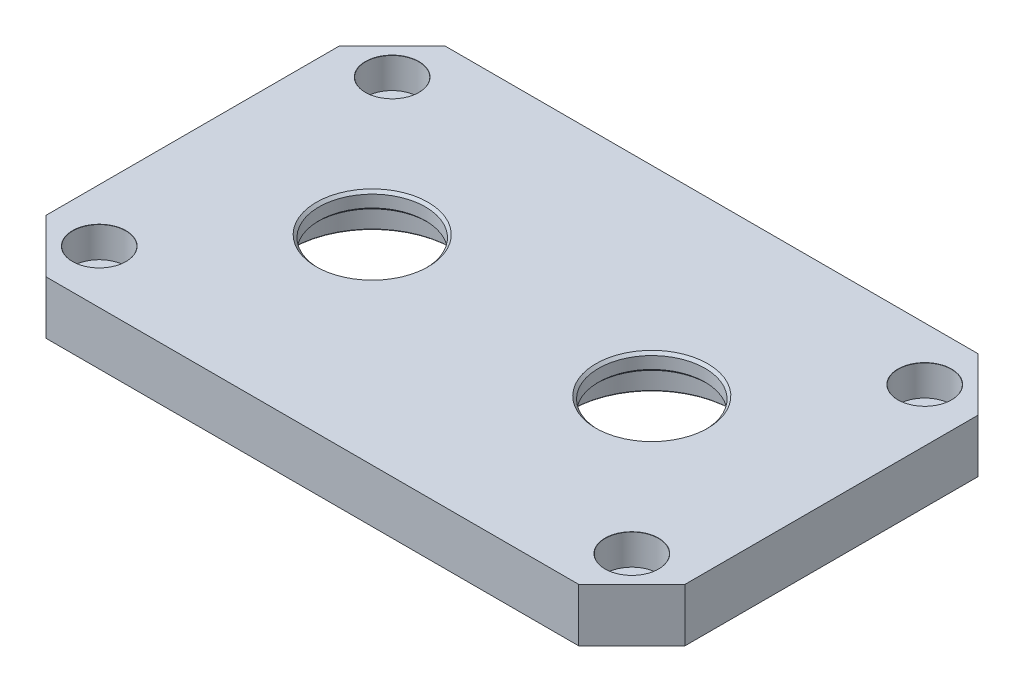
from build123d import *

# Parameters (mm, degrees)
SKETCH1_W           = 96
SKETCH1_H           = 60
BOSS_EXTRUDE1_DEPTH = 8
CHAMFER1_SIZE       = 8
HOLE4_D             = 24.1
HOLE4_DEPTH         = 5.2
SKETCH10_R          = 10
CUT_EXTRUDE1_DEPTH  = 0.2
CHAMFER2_SIZE       = 0.2
SKETCH11_R          = 3.1
CUT_EXTRUDE2_DEPTH  = 2.2
CHAMFER3_SIZE       = 0.2
SKETCH15_R          = 8
CUT_EXTRUDE3_DEPTH  = 57.860882863
CHAMFER4_SIZE       = 0.4


# Read off the part's stored shape, not the designer's step: CBORE for M4 SHCS1, Sketch-Pattern1
with BuildPart() as part:
    # Sketch1 → Boss-Extrude1 (new body)
    with BuildSketch(Plane(origin=(0, 0, 0), x_dir=(1, 0, 0), z_dir=(0, 1, 0))):
        Rectangle(SKETCH1_W, SKETCH1_H)
    extrude(amount=BOSS_EXTRUDE1_DEPTH)

    # Chamfer1
    chamfer1_edges = [part.edges().sort_by_distance(p)[0] for p in [
        (48, 4, 30),
        (-48, 4, 30),
        (-48, 4, -30),
        (48, 4, -30),
    ]]
    chamfer(chamfer1_edges, length=CHAMFER1_SIZE)

    # Hole4
    with Locations(Plane(origin=(0, 0, 0), x_dir=(-1, 0, 0), z_dir=(0, -1, 0))):
        with Locations((21, 0), (-21, 0)):
            Hole(HOLE4_D / 2, depth=HOLE4_DEPTH)

    # CBORE for M4 SHCS1 outline → CBORE for M4 SHCS1 (revolve, cut)
    with BuildSketch(Plane(origin=(40, 0, 22), x_dir=(1, 0, 0), z_dir=(0, 0, 1))):
        Polygon((0, 0), (2.25, 0), (2.25, 3.4), (4, 3.4), (4, 7.975), (4.025, 8), (0, 8), align=None)
    revolve(axis=Axis((40, 0, 22), (0, 1, 0)), mode=Mode.SUBTRACT)

    # CBORE for M4 SHCS1 2 outline → CBORE for M4 SHCS1 2 (revolve, cut)
    with BuildSketch(Plane(origin=(-40, 0, -22), x_dir=(1, 0, 0), z_dir=(0, 0, 1))):
        Polygon((0, 8), (0, 0), (2.25, 0), (2.25, 3.4), (4, 3.4), (4, 7.975), (4.025, 8), align=None)
    revolve(axis=Axis((-40, 0, -22), (0, 1, 0)), mode=Mode.SUBTRACT)

    # CBORE for M4 SHCS1 3 outline → CBORE for M4 SHCS1 3 (revolve, cut)
    with BuildSketch(Plane(origin=(-40, 0, 22), x_dir=(1, 0, 0), z_dir=(0, 0, 1))):
        Polygon((0, 8), (0, 0), (2.25, 0), (2.25, 3.4), (4, 3.4), (4, 7.975), (4.025, 8), align=None)
    revolve(axis=Axis((-40, 0, 22), (0, 1, 0)), mode=Mode.SUBTRACT)

    # CBORE for M4 SHCS1 4 outline → CBORE for M4 SHCS1 4 (revolve, cut)
    with BuildSketch(Plane(origin=(40, 0, -22), x_dir=(1, 0, 0), z_dir=(0, 0, 1))):
        Polygon((0, 8), (0, 0), (2.25, 0), (2.25, 3.4), (4, 3.4), (4, 7.975), (4.025, 8), align=None)
    revolve(axis=Axis((40, 0, -22), (0, 1, 0)), mode=Mode.SUBTRACT)

    # Sketch10 → Cut-Extrude1 (cut)
    with BuildSketch(Plane.XZ.offset(-5.2)):
        with Locations(Location((-21, 0, 0), (0, 0, 270))):
            Circle(SKETCH10_R)
        with Locations(Location((21, 0, 0), (0, 0, 270))):
            Circle(SKETCH10_R)
    extrude(amount=-CUT_EXTRUDE1_DEPTH, mode=Mode.SUBTRACT)

    # Chamfer2
    chamfer2_edges = [part.edges().sort_by_distance(p)[0] for p in [
        (-33.05, 0, 0),
        (8.95, 0, 0),
        (-21, 5.4, 10),
        (21, 5.2, 10),
    ]]
    chamfer(chamfer2_edges, length=CHAMFER2_SIZE - 0.0001)  # a hair under: the kernel refuses the full size

    # Sketch11 → Cut-Extrude2 (cut)
    with BuildSketch(Plane.XZ):
        with Locations(Location((-40, 22, 0), (0, 0, 270))):
            Circle(SKETCH11_R)
    extrude(amount=-CUT_EXTRUDE2_DEPTH, mode=Mode.SUBTRACT)

    # Chamfer3
    chamfer3_edges = [part.edges().sort_by_distance(p)[0] for p in [
        (-40, 0, 25.1),
        (-42.25, 2.2, 22),
    ]]
    chamfer(chamfer3_edges, length=CHAMFER3_SIZE)

    # Sketch-Pattern1 outline → Sketch-Pattern1 (revolve, cut)
    with BuildSketch(Plane(origin=(40, 0, -22), x_dir=(1, 0, 0), z_dir=(0, 0, 1))):
        Polygon((3.1, 2.2), (2.25, 2.2), (2.25, 0), (3.3, 0), (3.1, 0.2), align=None)
    revolve(axis=Axis((40, 0, -22), (0, 1, 0)), mode=Mode.SUBTRACT)

    # Sketch-Pattern1 2 outline → Sketch-Pattern1 2 (revolve, cut)
    with BuildSketch(Plane(origin=(-40, 0, -22), x_dir=(1, 0, 0), z_dir=(0, 0, 1))):
        Polygon((3.1, 2.2), (2.25, 2.2), (2.25, 0), (3.3, 0), (3.1, 0.2), align=None)
    revolve(axis=Axis((-40, 0, -22), (0, 1, 0)), mode=Mode.SUBTRACT)

    # Sketch-Pattern1 3 outline → Sketch-Pattern1 3 (revolve, cut)
    with BuildSketch(Plane(origin=(40, 0, 22), x_dir=(1, 0, 0), z_dir=(0, 0, 1))):
        Polygon((3.1, 2.2), (2.25, 2.2), (2.25, 0), (3.3, 0), (3.1, 0.2), align=None)
    revolve(axis=Axis((40, 0, 22), (0, 1, 0)), mode=Mode.SUBTRACT)

    # Sketch15 → Cut-Extrude3 (cut, through all)
    with BuildSketch(Plane.XZ.offset(-5.4)):
        with Locations(Location((-21, 0, 0), (0, 0, 270))):
            Circle(SKETCH15_R)
        with Locations(Location((21, 0, 0), (0, 0, 270))):
            Circle(SKETCH15_R)
    extrude(amount=-CUT_EXTRUDE3_DEPTH, mode=Mode.SUBTRACT)

    # Chamfer4
    chamfer4_edges = [part.edges().sort_by_distance(p)[0] for p in [
        (-21, 8, 8),
        (-21, 5.4, 8),
        (21, 8, 8),
        (21, 5.4, 8),
    ]]
    chamfer(chamfer4_edges, length=CHAMFER4_SIZE)


solid = part.part
